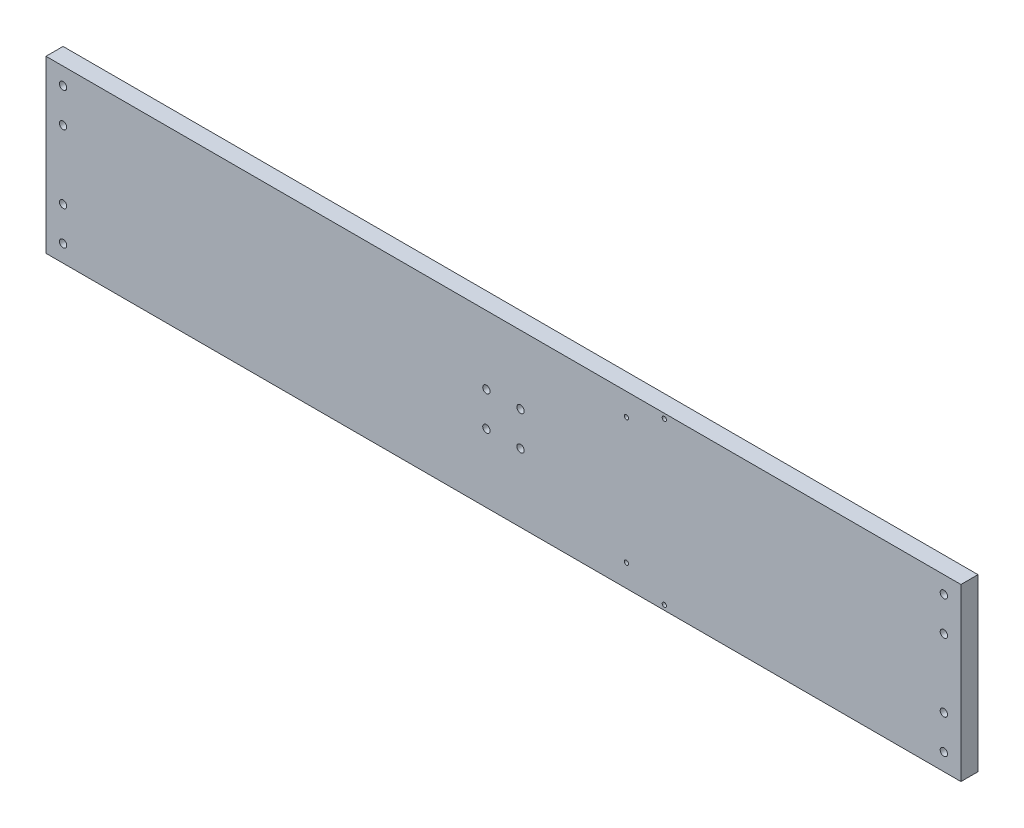
from build123d import *

# Parameters (mm, degrees)
SCHIZZO1_W                   = 536
SCHIZZO1_H                   = 100
SCHIZZO1_R                   = 2.15
ESTRUSIONE_ESTRUSIONE1_DEPTH = 10
SCHIZZO2_R                   = 2.15
TAGLIO_ESTRUSIONE1_DEPTH     = 546.340260755
M3_TAPPED_HOLE1_D            = 2.5
M3_TAPPED_HOLE1_DEPTH        = 11.5
M3_TAPPED_HOLE1_TIP          = 0.751075774


with BuildPart() as part:
    # Schizzo1 → Estrusione-Estrusione1 (new body)
    with BuildSketch(Plane.XY):
        with Locations((268, 50)):
            Rectangle(SCHIZZO1_W, SCHIZZO1_H)
        with Locations((10, 90)):
            Circle(SCHIZZO1_R, mode=Mode.SUBTRACT)
        with Locations((10, 70)):
            Circle(SCHIZZO1_R, mode=Mode.SUBTRACT)
        with Locations((10, 30)):
            Circle(SCHIZZO1_R, mode=Mode.SUBTRACT)
        with Locations((526, 10)):
            Circle(SCHIZZO1_R, mode=Mode.SUBTRACT)
        with Locations((526, 30)):
            Circle(SCHIZZO1_R, mode=Mode.SUBTRACT)
        with Locations((526, 70)):
            Circle(SCHIZZO1_R, mode=Mode.SUBTRACT)
        with Locations((10, 10)):
            Circle(SCHIZZO1_R, mode=Mode.SUBTRACT)
        with Locations((526, 90)):
            Circle(SCHIZZO1_R, mode=Mode.SUBTRACT)
    extrude(amount=-ESTRUSIONE_ESTRUSIONE1_DEPTH)

    # Schizzo2 → Taglio-Estrusione1 (cut, through all)
    with BuildSketch(Plane.XY):
        with Locations((258, 60)):
            Circle(SCHIZZO2_R)
        with Locations((278, 60)):
            Circle(SCHIZZO2_R)
        with Locations((278, 40)):
            Circle(SCHIZZO2_R)
        with Locations((258, 40)):
            Circle(SCHIZZO2_R)
    extrude(amount=-TAGLIO_ESTRUSIONE1_DEPTH, mode=Mode.SUBTRACT)

    # M3 Tapped Hole1
    with Locations(Plane(origin=(362.247113875, 97.2, 0), x_dir=(1, 0, 0), z_dir=(0, 0, 1))):
        with Locations((0, 0), (-22.2, -10.3), (-22.2, -84.1), (0, -94.4)):
            Hole(M3_TAPPED_HOLE1_D / 2, depth=M3_TAPPED_HOLE1_DEPTH)
            with Locations((0, 0, -(M3_TAPPED_HOLE1_DEPTH + M3_TAPPED_HOLE1_TIP / 2))):  # 118° drill point
                Cone(0, M3_TAPPED_HOLE1_D / 2, M3_TAPPED_HOLE1_TIP, mode=Mode.SUBTRACT)


solid = part.part
